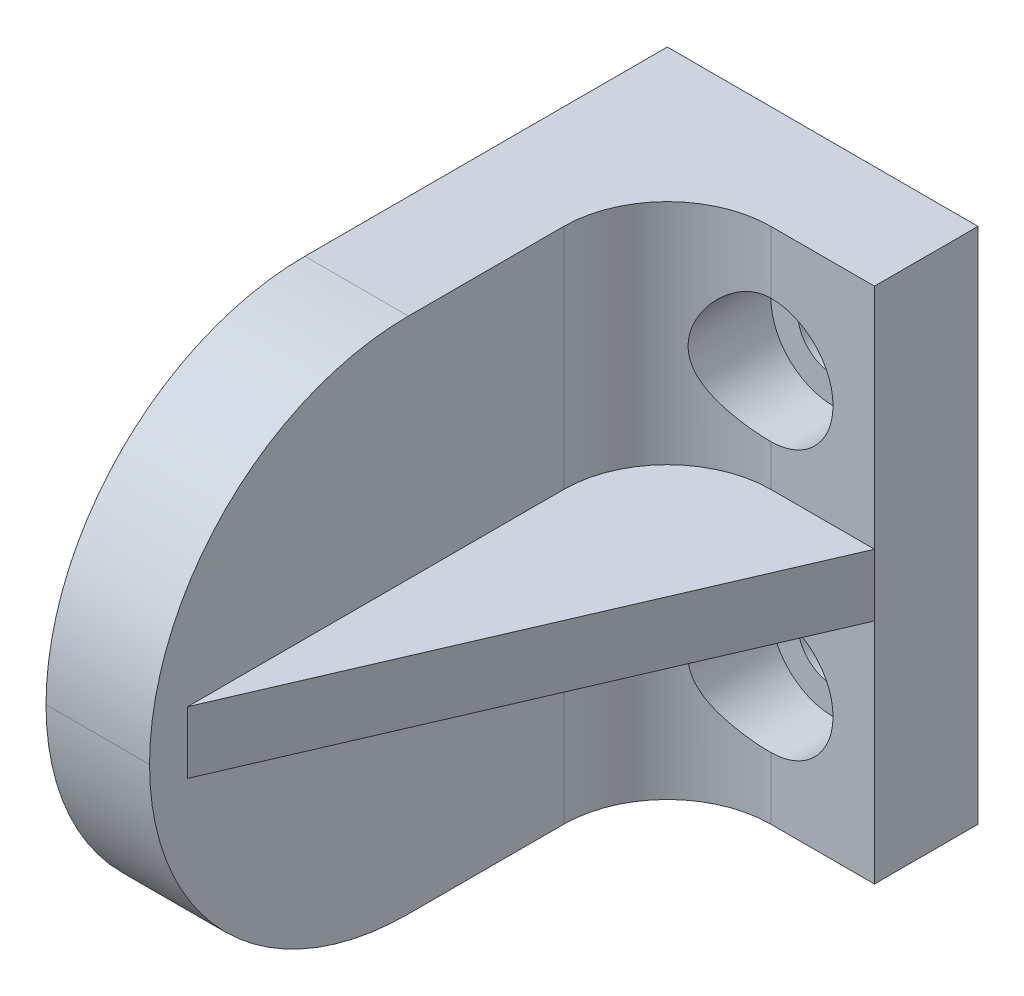
from build123d import *

# Parameters (mm, degrees)
SKETCH1_W           = 10
SKETCH1_H           = 25
SKETCH1_R           = 1.7
BOSS_EXTRUDE1_DEPTH = 5
SKETCH2_W           = 25
SKETCH2_H           = 25
SKETCH2_W_2         = 5
BOSS_EXTRUDE2_DEPTH = 5
SKETCH3_R           = 3.95
BOSS_EXTRUDE3_DEPTH = 3
SKETCH4_R           = 3
CUT_EXTRUDE1_DEPTH  = 3
FILLET1_R           = 12.5
BOSS_EXTRUDE4_DEPTH = 1.5
FILLET2_R           = 5


# Some blends are built 0.0001 mm under size
with BuildPart() as part:
    # Sketch1 → Boss-Extrude1 (new body)
    with BuildSketch(Plane.XY):
        with Locations((259.023766163, 223.42362241)):
            Rectangle(SKETCH1_W, SKETCH1_H)
        with Locations((259.023766163, 229.92362241)):
            Circle(SKETCH1_R, mode=Mode.SUBTRACT)
        with Locations((259.023766163, 216.92362241)):
            Circle(SKETCH1_R, mode=Mode.SUBTRACT)
    extrude(amount=BOSS_EXTRUDE1_DEPTH)

    # Sketch2 → Boss-Extrude2 (add)
    with BuildSketch(Plane.ZY.offset(-254.023766163)):
        with Locations((17.5, 223.42362241)):
            Rectangle(SKETCH2_W, SKETCH2_H)
        with Locations((2.5, 223.42362241)):
            Rectangle(SKETCH2_W_2, SKETCH2_H)
    extrude(amount=BOSS_EXTRUDE2_DEPTH)

    # Sketch3 → Boss-Extrude3 (add)
    with BuildSketch(Plane.ZY.offset(-249.023766163)):
        with Locations((17.5, 223.42362241)):
            Circle(SKETCH3_R)
    extrude(amount=BOSS_EXTRUDE3_DEPTH)

    # Sketch4 → Cut-Extrude1 (cut)
    with BuildSketch(Plane.XY.offset(5)):
        with Locations((259.023766163, 216.92362241)):
            Circle(SKETCH4_R)
        with Locations((259.023766163, 229.92362241)):
            Circle(SKETCH4_R)
    extrude(amount=-CUT_EXTRUDE1_DEPTH, mode=Mode.SUBTRACT)

    # Fillet1
    fillet1_edges = [part.edges().sort_by_distance(p)[0] for p in [
        (251.523766163, 210.92362241, 30),
        (251.523766163, 235.92362241, 30),
    ]]
    fillet(fillet1_edges, radius=FILLET1_R - 0.0001)  # a hair under: the kernel refuses the full size

    # Sketch5 → Boss-Extrude4 (add, symmetric)
    with BuildSketch(Plane(origin=(0, 223.42362241, 0), x_dir=(1, 0, 0), z_dir=(0, 1, 0))):
        Polygon((254.023766163, -28.1700362), (264.023766163, -5), (254.023766163, -5), (254.023766163, -17.5), align=None)
    extrude(amount=BOSS_EXTRUDE4_DEPTH, both=True)

    # Fillet2
    # the kernel refuses this fillet: 5 mm, written as the material it adds along each edge
    with BuildSketch(Plane(origin=(254.023766163, 235.92362241, 5), x_dir=(0, 0, 1), z_dir=(0, -1, 0))) as fillet2_piece_1_section:
        with BuildLine():
            CenterArc((FILLET2_R, -FILLET2_R), FILLET2_R, 90, 90)
            Line((0, -FILLET2_R), (0, 0))
            Line((0, 0), (FILLET2_R, 0))
        make_face()
    fillet2_piece_1 = extrude(amount=23.5, mode=Mode.PRIVATE)
    fillet2_piece_1 = fillet2_piece_1 - Plane(origin=(259.023766163, 229.92362241, 6.20300882), x_dir=(1, 0, 0), z_dir=(0, 0, 1)) * Cylinder(3, 68, mode=Mode.PRIVATE)
    fillet2_piece_1 = fillet2_piece_1 - Plane(origin=(259.023766163, 216.92362241, 6.20300882), x_dir=(1, 0, 0), z_dir=(0, 0, 1)) * Cylinder(3, 68, mode=Mode.PRIVATE)
    add(fillet2_piece_1)
    with BuildSketch(Plane(origin=(254.023766163, 234.42362241, 5), x_dir=(0, 0, 1), z_dir=(0, -1, 0))) as fillet2_piece_2_section:
        with BuildLine():
            CenterArc((FILLET2_R, -FILLET2_R), FILLET2_R, 90, 90)
            Line((0, -FILLET2_R), (0, 0))
            Line((0, 0), (FILLET2_R, 0))
        make_face()
    fillet2_piece_2 = extrude(amount=23.5, mode=Mode.PRIVATE)
    fillet2_piece_2 = fillet2_piece_2 - Plane(origin=(259.023766163, 229.92362241, 6.193943695), x_dir=(1, 0, 0), z_dir=(0, 0, 1)) * Cylinder(3, 67, mode=Mode.PRIVATE)
    fillet2_piece_2 = fillet2_piece_2 - Plane(origin=(259.023766163, 216.92362241, 6.193943695), x_dir=(1, 0, 0), z_dir=(0, 0, 1)) * Cylinder(3, 67, mode=Mode.PRIVATE)
    add(fillet2_piece_2)


solid = part.part
